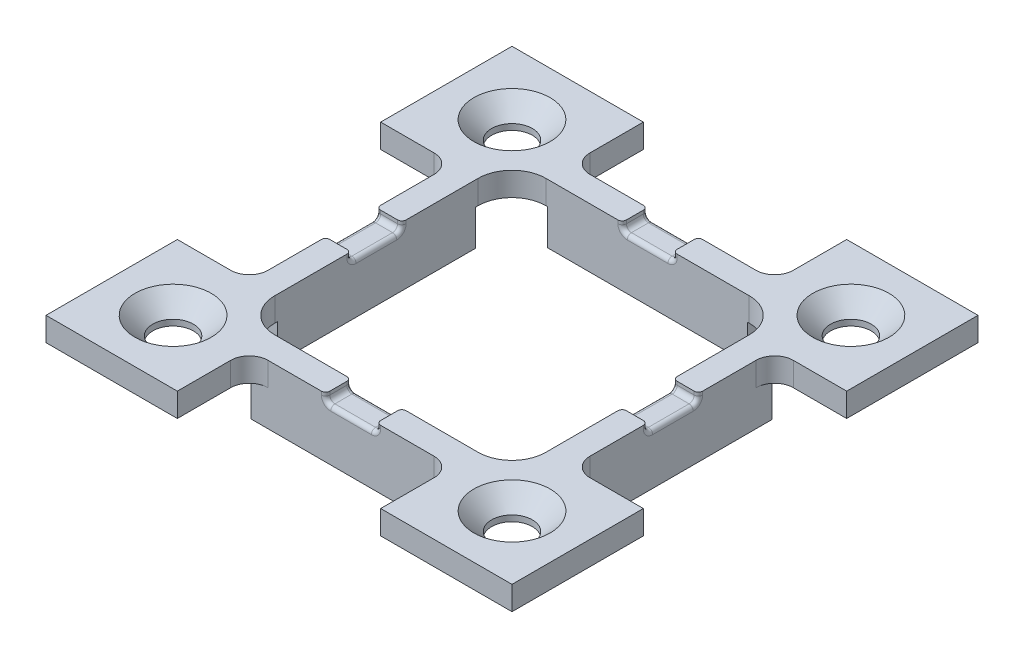
from build123d import *

# Parameters (mm, degrees)
SKETCH1_R                   = 1.2
BOSS_EXTRUDE1_DEPTH         = 1.4
SKETCH2_R                   = 2.25
CUT_EXTRUDE1_DEPTH          = 1.1
CUT_EXTRUDE1_DRAFT          = -45
SKETCH3_W                   = 12
SKETCH3_H                   = 1.5
BOSS_EXTRUDE2_DEPTH         = 3.5
CIRPATTERN1_COUNT           = 2
CIRPATTERN1_ANGLE           = 90
CIRPATTERN1_COPY_1_SKETCH_R = 2.25
CIRPATTERN1_COPY_1_DEPTH    = 1.1
CIRPATTERN1_COPY_1_DRAFT    = -45
CIRPATTERN2_OUTLINE_R       = 2.25
CIRPATTERN2_OUTLINE_R_2     = 1.2
CIRPATTERN2_DEPTH           = 1.4
CIRPATTERN2_START           = -2.1
CIRPATTERN2_2_OUTLINE_W     = 12
CIRPATTERN2_2_OUTLINE_H     = 1.5
CIRPATTERN2_2_OUTLINE_W_2   = 1.5
CIRPATTERN2_2_OUTLINE_H_2   = 12
CIRPATTERN2_2_DEPTH         = 2.1
CIRPATTERN3_COPY_1_SKETCH_R = 2.25
CIRPATTERN3_COPY_1_DEPTH    = 1.1
CIRPATTERN3_COPY_1_DRAFT    = -45
CIRPATTERN3_COPY_2_SKETCH_R = 2.25
CIRPATTERN3_COPY_2_DEPTH    = 1.1
CIRPATTERN3_COPY_2_DRAFT    = -45
CIRPATTERN3_COPY_3_SKETCH_R = 2.25
CIRPATTERN3_COPY_3_DEPTH    = 1.1
CIRPATTERN3_COPY_3_DRAFT    = -45
CUT_EXTRUDE2_DEPTH          = 3
CIRPATTERN4_COUNT           = 4
FILLET2_R                   = 0.25
CUT_EXTRUDE3_DEPTH          = 32.183489221
CUT_EXTRUDE3_DEPTH_BACK     = 32.183489221
SKETCH5_W                   = 28
SKETCH5_H                   = 28
SKETCH5_W_2                 = 27.5
SKETCH5_H_2                 = 27.5
FILLET3_R                   = 2
FILLET4_R                   = 1.1
CUT_EXTRUDE4_DEPTH          = 31.830747639
CUT_EXTRUDE4_DEPTH_BACK     = 31.830747639
SKETCH6_W                   = 0.1
SKETCH6_H                   = 2.1
CUT_EXTRUDE5_DEPTH          = 31.830747639
CUT_EXTRUDE5_DEPTH_BACK     = 31.830747639
SKETCH7_W                   = 0.15
SKETCH7_H                   = 2.1


with BuildPart() as part:
    # Sketch1 → Boss-Extrude1 (new body)
    with BuildSketch(Plane(origin=(0, 0, 0), x_dir=(1, 0, 0), z_dir=(0, 1, 0))):
        Polygon((0, 0), (0, 2), (-6, 2), (-6, -6), (2, -6), (2, 0), align=None)
        with Locations(Location((-2, -2, 0), (0, 0, 270))):
            Circle(SKETCH1_R, mode=Mode.SUBTRACT)
    boss_extrude1 = extrude(amount=BOSS_EXTRUDE1_DEPTH)


with BuildPart() as cut_extrude1_tool:
    # Sketch2 → Cut-Extrude1 (with draft: the straight prism first)
    with BuildSketch(Plane(origin=(0, 1.4, 0), x_dir=(1, 0, 0), z_dir=(0, 1, 0))):
        with Locations((-2, -2)):
            Circle(SKETCH2_R)
    extrude(amount=-CUT_EXTRUDE1_DEPTH)
    # Cut-Extrude1: the draft: its side faces are tilted about the plane it starts from
    cut_extrude1_sides = [cut_extrude1_tool.faces().sort_by_distance(p)[0] for p in [
        (-4.25, 0.85, 2),
    ]]
    draft(cut_extrude1_sides, Plane(origin=(0, 1.4, 0), x_dir=(1, 0, 0), z_dir=(0, 1, 0)), CUT_EXTRUDE1_DRAFT)


with BuildPart() as part_1:
    add(part.part)

    # Cut-Extrude1: cut by cut_extrude1_tool
    add(cut_extrude1_tool.part, mode=Mode.SUBTRACT)

    # Sketch3 → Boss-Extrude2 (add)
    with BuildSketch(Plane(origin=(0, 1.4, 0), x_dir=(1, 0, 0), z_dir=(0, 1, 0))):
        with Locations((8, -0.75)):
            Rectangle(SKETCH3_W, SKETCH3_H)
    boss_extrude2 = extrude(amount=-BOSS_EXTRUDE2_DEPTH)

    # CirPattern1: Boss-Extrude1, Boss-Extrude2 ×2 about axis
    cirpattern1_axis = Axis((8, 0, -8), (0, 1, 0))
    add([boss_extrude1.rotate(cirpattern1_axis, i * CIRPATTERN1_ANGLE / (CIRPATTERN1_COUNT - 1)) for i in range(1, CIRPATTERN1_COUNT)])
    add([boss_extrude2.rotate(cirpattern1_axis, i * CIRPATTERN1_ANGLE / (CIRPATTERN1_COUNT - 1)) for i in range(1, CIRPATTERN1_COUNT)])


with BuildPart() as cirpattern1_copy_1_tool:
    # CirPattern1 copy 1 sketch → CirPattern1 copy 1 (with draft: the straight prism first)
    with BuildSketch(Plane(origin=(16, 1.4, 0), x_dir=(0, 0, -1), z_dir=(0, 1, 0))):
        with Locations((-2, -2)):
            Circle(CIRPATTERN1_COPY_1_SKETCH_R)
    extrude(amount=-CIRPATTERN1_COPY_1_DEPTH)
    # CirPattern1 copy 1: the draft: its side faces are tilted about the plane it starts from
    cirpattern1_copy_1_sides = [cirpattern1_copy_1_tool.faces().sort_by_distance(p)[0] for p in [
        (18, 0.85, 4.25),
    ]]
    draft(cirpattern1_copy_1_sides, Plane(origin=(16, 1.4, 0), x_dir=(0, 0, -1), z_dir=(0, 1, 0)), CIRPATTERN1_COPY_1_DRAFT)


with BuildPart() as part_2:
    add(part_1.part)

    # CirPattern1 copy 1: cut by cirpattern1_copy_1_tool
    add(cirpattern1_copy_1_tool.part, mode=Mode.SUBTRACT)

    # CirPattern2: read off the stored shape, not the designer's step
    # CirPattern2 outline → CirPattern2 (add)
    with BuildSketch(Plane(origin=(0, 0, 0), x_dir=(1, 0, 0), z_dir=(0, 1, 0))):
        Polygon((22, -6), (22, 2), (17.5, 2), (17.5, 14), (22, 14), (22, 22), (14, 22), (14, 17.5), (2, 17.5), (2, 16), (16, 16), (16, 0), (0, 0), (0, 14), (-1.5, 14), (-1.5, 2), (-6, 2), (-6, -6), (2, -6), (2, -1.5), (14, -1.5), (14, -6), align=None)
        with Locations((-2, -2)):
            Circle(CIRPATTERN2_OUTLINE_R, mode=Mode.SUBTRACT)
        with Locations((18, -2)):
            Circle(CIRPATTERN2_OUTLINE_R_2, mode=Mode.SUBTRACT)
        with Locations((18, 18)):
            Circle(CIRPATTERN2_OUTLINE_R_2, mode=Mode.SUBTRACT)
    extrude(amount=CIRPATTERN2_DEPTH)

    # CirPattern2 2 outline → CirPattern2 2 (add)
    with BuildSketch(Plane(origin=(0, 0, 0), x_dir=(1, 0, 0), z_dir=(0, 1, 0)).offset(CIRPATTERN2_START)):
        with Locations((8, 16.75)):
            Rectangle(CIRPATTERN2_2_OUTLINE_W, CIRPATTERN2_2_OUTLINE_H)
        with Locations((-0.75, 8)):
            Rectangle(CIRPATTERN2_2_OUTLINE_W_2, CIRPATTERN2_2_OUTLINE_H_2)
    extrude(amount=CIRPATTERN2_2_DEPTH)

    # Mirror1: Boss-Extrude1 across plane
    add(boss_extrude1.mirror(Plane(origin=(0, 0, -8), x_dir=(1, 0, 0), z_dir=(0, 0, -1))))


with BuildPart() as cirpattern3_copy_1_tool:
    # CirPattern3 copy 1 sketch → CirPattern3 copy 1 (with draft: the straight prism first)
    with BuildSketch(Plane(origin=(16, 1.4, 0), x_dir=(0, 0, -1), z_dir=(0, 1, 0))):
        with Locations((-2, -2)):
            Circle(CIRPATTERN3_COPY_1_SKETCH_R)
    extrude(amount=-CIRPATTERN3_COPY_1_DEPTH)
    # CirPattern3 copy 1: the draft: its side faces are tilted about the plane it starts from
    cirpattern3_copy_1_sides = [cirpattern3_copy_1_tool.faces().sort_by_distance(p)[0] for p in [
        (18, 0.85, 4.25),
    ]]
    draft(cirpattern3_copy_1_sides, Plane(origin=(16, 1.4, 0), x_dir=(0, 0, -1), z_dir=(0, 1, 0)), CIRPATTERN3_COPY_1_DRAFT)


with BuildPart() as part_3:
    add(part_2.part)

    # CirPattern3 copy 1: cut by cirpattern3_copy_1_tool
    add(cirpattern3_copy_1_tool.part, mode=Mode.SUBTRACT)


with BuildPart() as cirpattern3_copy_2_tool:
    # CirPattern3 copy 2 sketch → CirPattern3 copy 2 (with draft: the straight prism first)
    with BuildSketch(Plane(origin=(16, 1.4, -16), x_dir=(-1, 0, 0), z_dir=(0, 1, 0))):
        with Locations((-2, -2)):
            Circle(CIRPATTERN3_COPY_2_SKETCH_R)
    extrude(amount=-CIRPATTERN3_COPY_2_DEPTH)
    # CirPattern3 copy 2: the draft: its side faces are tilted about the plane it starts from
    cirpattern3_copy_2_sides = [cirpattern3_copy_2_tool.faces().sort_by_distance(p)[0] for p in [
        (20.25, 0.85, -18),
    ]]
    draft(cirpattern3_copy_2_sides, Plane(origin=(16, 1.4, -16), x_dir=(-1, 0, 0), z_dir=(0, 1, 0)), CIRPATTERN3_COPY_2_DRAFT)


with BuildPart() as part_4:
    add(part_3.part)

    # CirPattern3 copy 2: cut by cirpattern3_copy_2_tool
    add(cirpattern3_copy_2_tool.part, mode=Mode.SUBTRACT)


with BuildPart() as cirpattern3_copy_3_tool:
    # CirPattern3 copy 3 sketch → CirPattern3 copy 3 (with draft: the straight prism first)
    with BuildSketch(Plane(origin=(0, 1.4, -16), x_dir=(0, 0, 1), z_dir=(0, 1, 0))):
        with Locations((-2, -2)):
            Circle(CIRPATTERN3_COPY_3_SKETCH_R)
    extrude(amount=-CIRPATTERN3_COPY_3_DEPTH)
    # CirPattern3 copy 3: the draft: its side faces are tilted about the plane it starts from
    cirpattern3_copy_3_sides = [cirpattern3_copy_3_tool.faces().sort_by_distance(p)[0] for p in [
        (-2, 0.85, -20.25),
    ]]
    draft(cirpattern3_copy_3_sides, Plane(origin=(0, 1.4, -16), x_dir=(0, 0, 1), z_dir=(0, 1, 0)), CIRPATTERN3_COPY_3_DRAFT)


with BuildPart() as part_5:
    add(part_4.part)

    # CirPattern3 copy 3: cut by cirpattern3_copy_3_tool
    add(cirpattern3_copy_3_tool.part, mode=Mode.SUBTRACT)

    # Sketch4 → Cut-Extrude2 (cut)
    with BuildSketch(Plane.XY.offset(1.5)):
        with BuildLine():
            Line((6.5, 1.4), (9.5, 1.4))
            Line((9.5, 1.4), (9.5, 1.2))
            ThreePointArc((9.5, 1.2), (9.412132034, 0.987867966), (9.2, 0.9))
            Line((9.2, 0.9), (6.8, 0.9))
            ThreePointArc((6.8, 0.9), (6.587867966, 0.987867966), (6.5, 1.2))
            Line((6.5, 1.2), (6.5, 1.4))
        make_face()
    cut_extrude2 = extrude(amount=-CUT_EXTRUDE2_DEPTH, mode=Mode.SUBTRACT)

    # CirPattern4: Cut-Extrude2 ×4 about axis
    cirpattern4_axis = Axis((8, 0, -8), (0, 1, 0))
    for i in range(1, CIRPATTERN4_COUNT):
        add(cut_extrude2.rotate(cirpattern4_axis, i * 360 / CIRPATTERN4_COUNT), mode=Mode.SUBTRACT)

    # Fillet2
    fillet2_edges = [part_5.edges().sort_by_distance(p)[0] for p in [
        (6.5, 1.3, 0),
        (9.5, 1.3, 0),
        (9.412132034, 0.987867966, 0),
        (8, 0.9, 0),
        (6.587867966, 0.987867966, 0),
        (6.5, 1.3, 1.5),
        (6.587867966, 0.987867966, 1.5),
        (8, 0.9, 1.5),
        (9.412132034, 0.987867966, 1.5),
        (9.5, 1.3, 1.5),
        (16, 1.3, -6.5),
        (16, 1.3, -9.5),
        (16, 0.987867966, -9.412132034),
        (16, 0.9, -8),
        (16, 0.987867966, -6.587867966),
        (17.5, 1.3, -6.5),
        (17.5, 0.987867966, -6.587867966),
        (17.5, 0.9, -8),
        (17.5, 0.987867966, -9.412132034),
        (17.5, 1.3, -9.5),
        (9.5, 1.3, -16),
        (6.5, 1.3, -16),
        (6.587867966, 0.987867966, -16),
        (8, 0.9, -16),
        (9.412132034, 0.987867966, -16),
        (9.5, 1.3, -17.5),
        (9.412132034, 0.987867966, -17.5),
        (8, 0.9, -17.5),
        (6.587867966, 0.987867966, -17.5),
        (6.5, 1.3, -17.5),
        (0, 1.3, -9.5),
        (0, 1.3, -6.5),
        (0, 0.987867966, -6.587867966),
        (0, 0.9, -8),
        (0, 0.987867966, -9.412132034),
        (-1.5, 1.3, -9.5),
        (-1.5, 0.987867966, -9.412132034),
        (-1.5, 0.9, -8),
        (-1.5, 0.987867966, -6.587867966),
        (-1.5, 1.3, -6.5),
    ]]
    fillet(fillet2_edges, radius=FILLET2_R)

    # Sketch5 → Cut-Extrude3 (cut, two sides: drawn at the far end of the back side and taken through both)
    with BuildSketch(Plane(origin=(0, 0, 0), x_dir=(1, 0, 0), z_dir=(0, 1, 0)).offset(-CUT_EXTRUDE3_DEPTH_BACK)):
        with Locations((8, 8)):
            Rectangle(SKETCH5_W, SKETCH5_H)
        with Locations((8, 8)):
            Rectangle(SKETCH5_W_2, SKETCH5_H_2, mode=Mode.SUBTRACT)
    extrude(amount=CUT_EXTRUDE3_DEPTH + CUT_EXTRUDE3_DEPTH_BACK, mode=Mode.SUBTRACT)

    # Fillet3
    fillet3_edges = [part_5.edges().sort_by_distance(p)[0] for p in [
        (16, 0.7, -16),
        (0, 0.7, 0),
        (0, 0.7, -16),
        (16, 0.7, 0),
    ]]
    fillet(fillet3_edges, radius=FILLET3_R)

    # Fillet4
    fillet4_edges = [part_5.edges().sort_by_distance(p)[0] for p in [
        (17.5, 0.7, -14),
        (14, 0.7, -17.5),
        (-1.5, 0.7, -2),
        (-1.5, 0.7, -14),
        (2, 0.7, -17.5),
        (2, 0.7, 1.5),
        (14, 0.7, 1.5),
        (17.5, 0.7, -2),
    ]]
    fillet(fillet4_edges, radius=FILLET4_R)

    # Sketch6 → Cut-Extrude4 (cut, two sides: drawn at the far end of the back side and taken through both)
    with BuildSketch(Plane.XY.offset(-CUT_EXTRUDE4_DEPTH_BACK)):
        with Locations((13.95, -1.05)):
            Rectangle(SKETCH6_W, SKETCH6_H)
        with Locations((2.05, -1.05)):
            Rectangle(SKETCH6_W, SKETCH6_H)
    extrude(amount=CUT_EXTRUDE4_DEPTH + CUT_EXTRUDE4_DEPTH_BACK, mode=Mode.SUBTRACT)

    # Sketch7 → Cut-Extrude5 (cut, two sides: drawn at the far end of the back side and taken through both)
    with BuildSketch(Plane(origin=(0, 0, 0), x_dir=(0, 0, -1), z_dir=(1, 0, 0)).offset(-CUT_EXTRUDE5_DEPTH_BACK)):
        with Locations((2.075, -1.05)):
            Rectangle(SKETCH7_W, SKETCH7_H)
        with Locations((13.925, -1.05)):
            Rectangle(SKETCH7_W, SKETCH7_H)
    extrude(amount=CUT_EXTRUDE5_DEPTH + CUT_EXTRUDE5_DEPTH_BACK, mode=Mode.SUBTRACT)


solid = part_5.part
